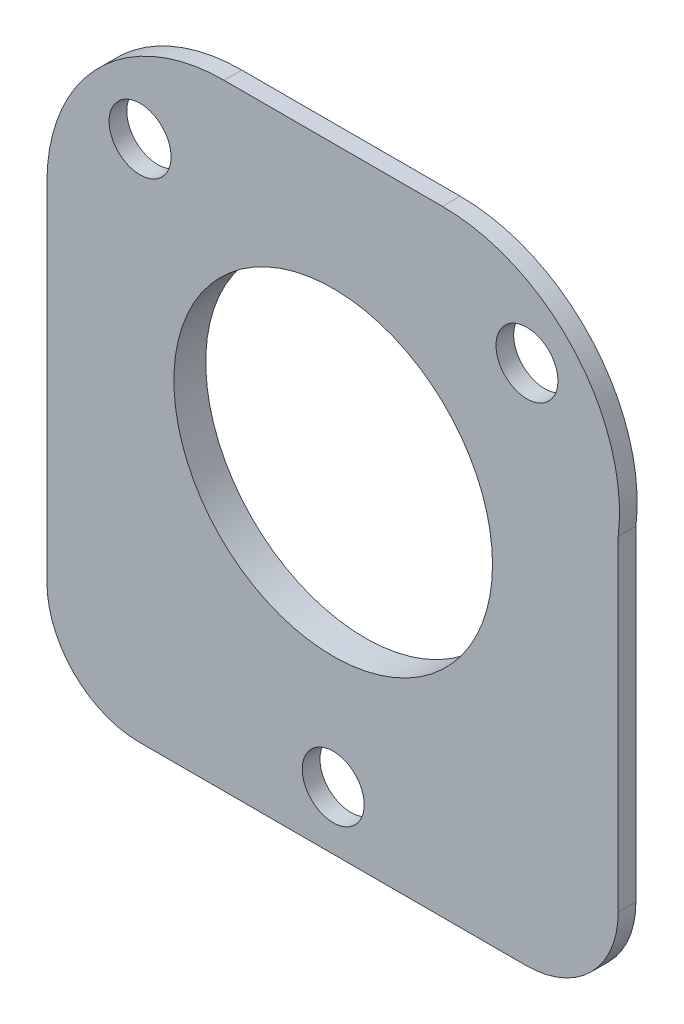
from build123d import *

# Parameters (mm, degrees)
SCHIZZO1_R                   = 1.75
SCHIZZO1_R_2                 = 12.1
ESTRUSIONE_ESTRUSIONE1_DEPTH = 1
ESTRUSIONE_ESTRUSIONE2_START = -1.8
SCHIZZO2_R                   = 12.1
SCHIZZO2_R_2                 = 9
ESTRUSIONE_ESTRUSIONE2_DEPTH = 1.8


with BuildPart() as part:
    # Schizzo1 → Estrusione-Estrusione1 (new body)
    with BuildSketch(Plane.XY):
        with BuildLine():
            Line((6.171311325, 16.1), (-6.171311325, 16.1))
            ThreePointArc((-6.171311325, 16.1), (-13.242379137, 13.171067812), (-16.171311325, 6.1))
            Line((-16.171311325, 6.1), (-16.171311325, -13.463208293))
            ThreePointArc((-16.171311325, -13.463208293), (-14.644226439, -17.149917336), (-10.957517396, -18.677002221))
            Line((-10.957517396, -18.677002221), (10.886206072, -18.677002221))
            ThreePointArc((10.886206072, -18.677002221), (14.572915114, -17.149917336), (16.1, -13.463208293))
            Line((16.1, -13.463208293), (16.1, 4.907883736))
            ThreePointArc((16.1, 4.907883736), (13.651991863, 12.73622021), (6.171311325, 16.1))
        make_face()
        with Locations((0, -15.38859776)):
            Circle(SCHIZZO1_R, mode=Mode.SUBTRACT)
        with Locations((-10.910719744, 10.851964601)):
            Circle(SCHIZZO1_R, mode=Mode.SUBTRACT)
        Circle(SCHIZZO1_R_2, mode=Mode.SUBTRACT)
        with Locations((10.944459062, 10.817992606)):
            Circle(SCHIZZO1_R, mode=Mode.SUBTRACT)
    extrude(amount=ESTRUSIONE_ESTRUSIONE1_DEPTH)

    # Schizzo2 → Estrusione-Estrusione2 (add)
    with BuildSketch(Plane.XY.offset(1).offset(ESTRUSIONE_ESTRUSIONE2_START)):
        Circle(SCHIZZO2_R)
        Circle(SCHIZZO2_R_2, mode=Mode.SUBTRACT)
    extrude(amount=ESTRUSIONE_ESTRUSIONE2_DEPTH)


solid = part.part
